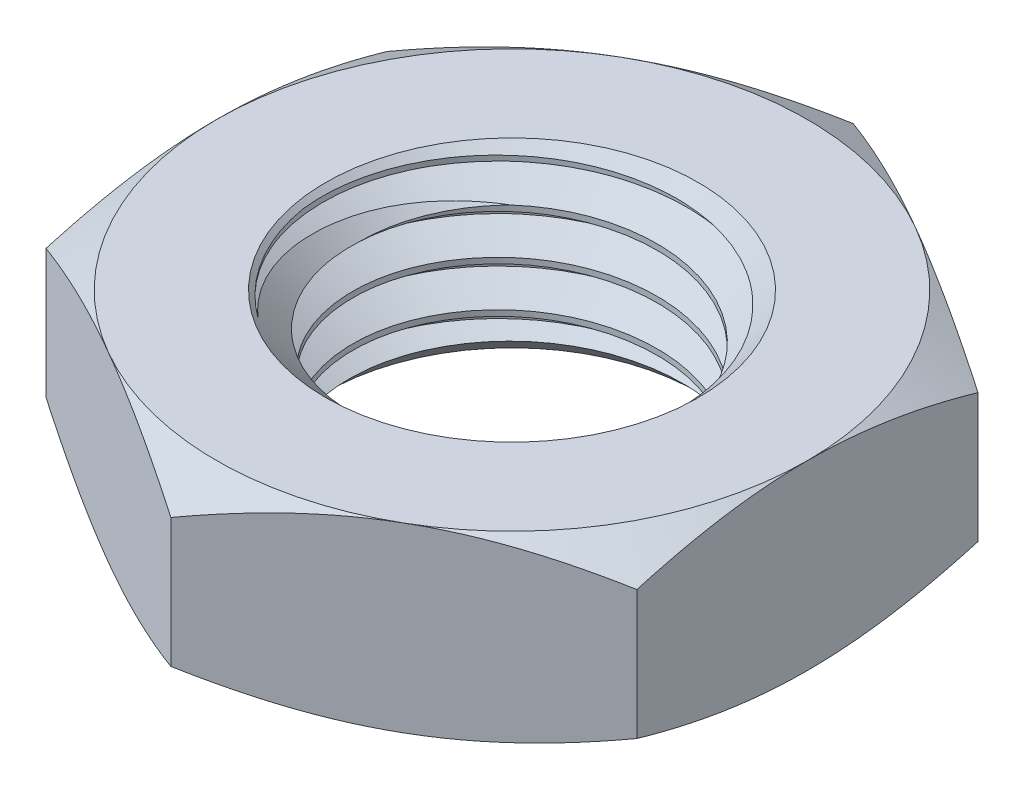
from build123d import *

# Parameters (mm, degrees)
SKETCH0_R                    = 4
BOSS_EXTRUDE1_DEPTH          = 2
SKETCH5_OUTSIDE_W            = 59.596
SKETCH5_OUTSIDE_H            = 61.608
SKETCH5_OUTSIDE_R            = 6.5
CUT_EXTRUDE2_DEPTH           = 11.704360482
CUT_EXTRUDE2_DRAFT           = -60
MIRROR2_COPY_1_SKETCH_W      = 59.596
MIRROR2_COPY_1_SKETCH_H      = 61.608
MIRROR2_COPY_1_SKETCH_R      = 6.5
MIRROR2_COPY_1_DEPTH         = 11.704360482
MIRROR2_COPY_1_DRAFT         = -60
SWEEP1_PITCH                 = 1
SKETCH9_R                    = 4.1
CUT_EXTRUDE3_OTHER_WAY_DEPTH = 12.617198991
CUT_EXTRUDE3_OTHER_WAY_DRAFT = -45
MIRROR3_COPY_1_SKETCH_R      = 4.1
MIRROR3_COPY_1_DEPTH         = 12.617198991
MIRROR3_COPY_1_DRAFT         = -45
MIRROR3_COPY_2_SKETCH_R      = 4.1
MIRROR3_COPY_2_DEPTH         = 12.617198991
MIRROR3_COPY_2_DRAFT         = -45


with BuildPart() as part:
    # Sketch0 → Boss-Extrude1 (new, symmetric)
    with BuildSketch(Plane(origin=(0, 0, 0), x_dir=(1, 0, 0), z_dir=(0, 1, 0))):
        Polygon((-6.5, 3.75277675), (-6.5, -3.75277675), (0, -7.505553499), (6.5, -3.75277675), (6.5, 3.75277675), (0, 7.505553499), align=None)
        with Locations(Location((0, 0, 0), (0, 0, 270))):
            Circle(SKETCH0_R, mode=Mode.SUBTRACT)
    extrude(amount=BOSS_EXTRUDE1_DEPTH, both=True)


with BuildPart() as cut_extrude2_tool:
    # Sketch5 outside → Cut-Extrude2 (with draft: the straight prism first)
    with BuildSketch(Plane(origin=(0, 2, 0), x_dir=(1, 0, 0), z_dir=(0, 1, 0))):
        Rectangle(SKETCH5_OUTSIDE_W, SKETCH5_OUTSIDE_H)
        Circle(SKETCH5_OUTSIDE_R, mode=Mode.SUBTRACT)
    extrude(amount=-CUT_EXTRUDE2_DEPTH)
    # Cut-Extrude2: the draft: its side faces are tilted about the plane it starts from
    cut_extrude2_sides = [cut_extrude2_tool.faces().sort_by_distance(p)[0] for p in [
        (0, -3.852180241, 30.804),
        (29.798, -3.852180241, 0),
        (0, -3.852180241, -30.804),
        (-29.798, -3.852180241, 0),
        (-6.5, -3.852180241, 0),
    ]]
    draft(cut_extrude2_sides, Plane(origin=(0, 2, 0), x_dir=(1, 0, 0), z_dir=(0, 1, 0)), CUT_EXTRUDE2_DRAFT)


with BuildPart() as part_1:
    add(part.part)

    # Cut-Extrude2: cut by cut_extrude2_tool
    add(cut_extrude2_tool.part, mode=Mode.SUBTRACT)


with BuildPart() as mirror2_copy_1_tool:
    # Mirror2 copy 1 sketch → Mirror2 copy 1 (with draft: the straight prism first)
    with BuildSketch(Plane.XZ.offset(2)):
        Rectangle(MIRROR2_COPY_1_SKETCH_W, MIRROR2_COPY_1_SKETCH_H)
        Circle(MIRROR2_COPY_1_SKETCH_R, mode=Mode.SUBTRACT)
    extrude(amount=-MIRROR2_COPY_1_DEPTH)
    # Mirror2 copy 1: the draft: its side faces are tilted about the plane it starts from
    mirror2_copy_1_sides = [mirror2_copy_1_tool.faces().sort_by_distance(p)[0] for p in [
        (0, 3.852180241, 30.804),
        (29.798, 3.852180241, 0),
        (0, 3.852180241, -30.804),
        (-29.798, 3.852180241, 0),
        (-6.5, 3.852180241, 0),
    ]]
    draft(mirror2_copy_1_sides, Plane.XZ.offset(2), MIRROR2_COPY_1_DRAFT)


with BuildPart() as part_2:
    add(part_1.part)

    # Mirror2 copy 1: cut by mirror2_copy_1_tool
    add(mirror2_copy_1_tool.part, mode=Mode.SUBTRACT)

    # Sweep1: arcs per turn and ends read off the stored shape
    # Sweep1: the profile of Sketch6 screwed along a right-hand helix through 6 turns, 8 arcs to a turn; built about Z, then put on its axis
    sweep1_z = Axis((0, 0, 0), (0, 0, 1))
    sweep1_corners = [(4.054126588, 0, 0.96875), (4.054126588, 0, 1.90625), (3.350480947, 0, 1.5), (3.350480947, 0, 1.375)]
    with BuildLine(mode=Mode.PRIVATE) as sweep1_profile:
        Line(sweep1_corners[0], sweep1_corners[1])
        Line(sweep1_corners[1], sweep1_corners[2])
        Line(sweep1_corners[2], sweep1_corners[3])
        Line(sweep1_corners[3], sweep1_corners[0])
    sweep1_cap = Face(sweep1_profile.wire())
    sweep1_turn_angles = [0, 22.5, 45, 67.5, 90, 112.5, 135, 157.5, 180, 202.5, 225, 247.5, 270, 292.5, 315, 337.5, 360]
    sweep1_turn_weights = [1, 0.9238795325112867, 1, 0.9238795325112867, 1, 0.9238795325112867, 1, 0.9238795325112867, 1, 0.9238795325112867, 1, 0.9238795325112867, 1, 0.9238795325112867, 1, 0.9238795325112867, 1]
    sweep1_turn_rails = [Edge.make_bspline([Vector(p[0], p[1], 0).rotate(sweep1_z, sweep1_turn_angles[k]) / sweep1_turn_weights[k] + Vector(0, 0, p[2] + SWEEP1_PITCH * sweep1_turn_angles[k] / 360) for k in range(17)], [0, 0, 0, 1, 1, 2, 2, 3, 3, 4, 4, 5, 5, 6, 6, 7, 7, 8, 8, 8], 2, sweep1_turn_weights) for p in sweep1_corners]
    sweep1_turn_sides = [Face.make_surface_from_curves(sweep1_turn_rails[p[0]], sweep1_turn_rails[p[1]]) for p in [(0, 1), (1, 2), (2, 3), (3, 0)]]
    sweep1 = Plane(origin=(0, 5, 0), x_dir=(0, 0, 1), z_dir=(0, -1, 0)) * Solid(Shell([*[p.moved(Location((0, 0, SWEEP1_PITCH * i))) for i in range(6) for p in sweep1_turn_sides], sweep1_cap, sweep1_cap.rotate(sweep1_z, 2160).moved(Location((0, 0, SWEEP1_PITCH * 2160 / 360)))]))
    add(sweep1)

    # Cut-Extrude3 cone 1 section (through the dimple's axis) → Cut-Extrude3 (revolve, cut)
    with BuildSketch(Plane(origin=(0, -2, 0), x_dir=(0, 0, -1), z_dir=(1, 0, 0))):
        Polygon((0, 0), (4.1, 0), (0, 4.1), align=None)
    cut_extrude3 = revolve(axis=Axis((0, -2, 0), (0, 1, 0)), mode=Mode.SUBTRACT)


with BuildPart() as cut_extrude3_other_way_tool:
    # Sketch9 → Cut-Extrude3 other way (with draft: the straight prism first)
    with BuildSketch(Plane.XZ.offset(2)):
        Circle(SKETCH9_R)
    extrude(amount=CUT_EXTRUDE3_OTHER_WAY_DEPTH)
    # Cut-Extrude3 other way: the draft: its side faces are tilted about the plane it starts from
    cut_extrude3_other_way_sides = [cut_extrude3_other_way_tool.faces().sort_by_distance(p)[0] for p in [
        (-4.1, -8.308599496, 0),
    ]]
    draft(cut_extrude3_other_way_sides, Plane.XZ.offset(2), CUT_EXTRUDE3_OTHER_WAY_DRAFT)


with BuildPart() as part_3:
    add(part_2.part)

    # Cut-Extrude3 other way: cut by cut_extrude3_other_way_tool
    add(cut_extrude3_other_way_tool.part, mode=Mode.SUBTRACT)

    # Mirror3: Cut-Extrude3 across plane
    add(cut_extrude3.mirror(Plane.ZX), mode=Mode.SUBTRACT)


with BuildPart() as mirror3_copy_1_tool:
    # Mirror3 copy 1 sketch → Mirror3 copy 1 (with draft: the straight prism first)
    with BuildSketch(Plane(origin=(0, 2, 0), x_dir=(1, 0, 0), z_dir=(0, 1, 0))):
        Circle(MIRROR3_COPY_1_SKETCH_R)
    extrude(amount=MIRROR3_COPY_1_DEPTH)
    # Mirror3 copy 1: the draft: its side faces are tilted about the plane it starts from
    mirror3_copy_1_sides = [mirror3_copy_1_tool.faces().sort_by_distance(p)[0] for p in [
        (-4.1, 8.308599496, 0),
    ]]
    draft(mirror3_copy_1_sides, Plane(origin=(0, 2, 0), x_dir=(1, 0, 0), z_dir=(0, 1, 0)), MIRROR3_COPY_1_DRAFT)


with BuildPart() as part_4:
    add(part_3.part)

    # Mirror3 copy 1: cut by mirror3_copy_1_tool
    add(mirror3_copy_1_tool.part, mode=Mode.SUBTRACT)


with BuildPart() as mirror3_copy_2_tool:
    # Mirror3 copy 2 sketch → Mirror3 copy 2 (with draft: the straight prism first)
    with BuildSketch(Plane(origin=(0, 2, 0), x_dir=(1, 0, 0), z_dir=(0, 1, 0))):
        Circle(MIRROR3_COPY_2_SKETCH_R)
    extrude(amount=MIRROR3_COPY_2_DEPTH)
    # Mirror3 copy 2: the draft: its side faces are tilted about the plane it starts from
    mirror3_copy_2_sides = [mirror3_copy_2_tool.faces().sort_by_distance(p)[0] for p in [
        (-4.1, 8.308599496, 0),
    ]]
    draft(mirror3_copy_2_sides, Plane(origin=(0, 2, 0), x_dir=(1, 0, 0), z_dir=(0, 1, 0)), MIRROR3_COPY_2_DRAFT)


with BuildPart() as part_5:
    add(part_4.part)

    # Mirror3 copy 2: cut by mirror3_copy_2_tool
    add(mirror3_copy_2_tool.part, mode=Mode.SUBTRACT)


solid = part_5.part
